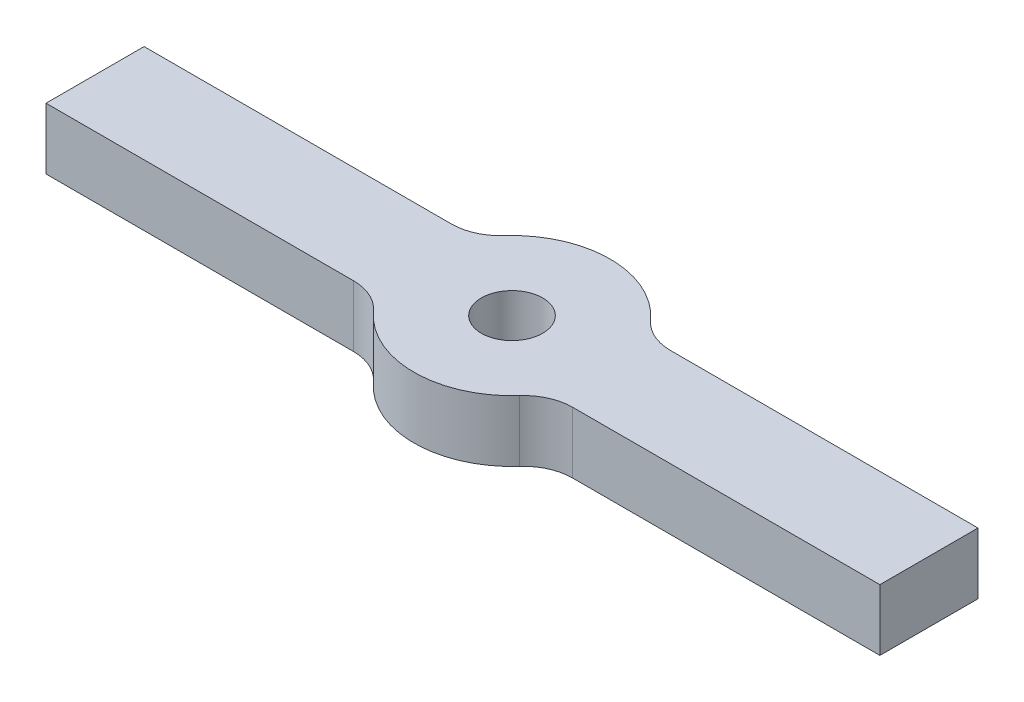
from build123d import *

# Parameters (mm, degrees)
SKETCH2_R           = 7.9375
BOSS_EXTRUDE1_DEPTH = 15.875
FILLET1_R           = 12.7


with BuildPart() as part:
    # Sketch2 → Boss-Extrude1 (new body)
    with BuildSketch(Plane(origin=(0, 0, 0), x_dir=(1, 0, 0), z_dir=(0, 1, 0))):
        with BuildLine():
            Line((-107.95, 0), (-107.95, -25.4))
            Line((-107.95, -25.4), (-21.997045256, -25.4))
            ThreePointArc((-21.997045256, -25.4), (0, -38.1), (21.997045256, -25.4))
            Line((21.997045256, -25.4), (107.95, -25.4))
            Line((107.95, -25.4), (107.95, 0))
            Line((107.95, 0), (21.997045256, 0))
            ThreePointArc((21.997045256, 0), (0, 12.7), (-21.997045256, 0))
            Line((-21.997045256, 0), (-107.95, 0))
        make_face()
        with Locations((0, -12.7)):
            Circle(SKETCH2_R, mode=Mode.SUBTRACT)
    extrude(amount=BOSS_EXTRUDE1_DEPTH)

    # Fillet1
    fillet1_edges = [part.edges().sort_by_distance(p)[0] for p in [
        (21.997045256, 7.9375, 0),
        (21.997045256, 7.9375, 25.4),
        (-21.997045256, 7.9375, 25.4),
        (-21.997045256, 7.9375, 0),
    ]]
    fillet(fillet1_edges, radius=FILLET1_R)


solid = part.part
